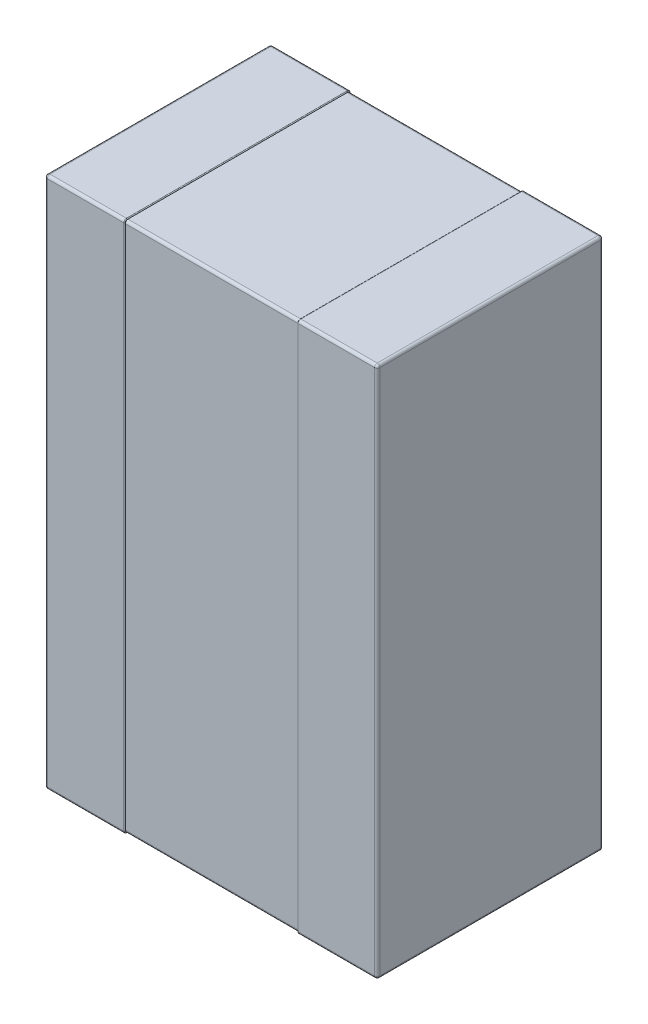
from build123d import *

# Parameters (mm, degrees)
SKETCH1_W                           = 1.25
SKETCH1_H                           = 2
ALL_BODY_DEPTH                      = 0.85
CUT_OUT_THE_BODY_FOR_PIN_DEPTH      = 0.325
CUT_OUT_THE_BODY_FOR_PIN_DEPTH_BACK = 0.325
SKETCH2_OUTSIDE_W                   = 3.352
SKETCH2_OUTSIDE_H                   = 4.502
SKETCH2_OUTSIDE_W_2                 = 0.844
SKETCH2_OUTSIDE_H_2                 = 1.994
BODY_FILLET_R                       = 0.01
PIN_FILLET_A_R                      = 0.01
PIN_FILLET_B_R                      = 0.003


with BuildPart() as part:
    # Sketch1 → All body (new body)
    with BuildSketch(Plane.XY):
        Rectangle(SKETCH1_W, SKETCH1_H)
    extrude(amount=ALL_BODY_DEPTH)

    # Sketch2 outside → Cut out the body for pin (cut, two sides: drawn at the far end of the back side and taken through both)
    with BuildSketch(Plane(origin=(0, 0, 0), x_dir=(0, 0, -1), z_dir=(1, 0, 0)).offset(-CUT_OUT_THE_BODY_FOR_PIN_DEPTH_BACK)):
        with Locations((-0.425, 0)):
            Rectangle(SKETCH2_OUTSIDE_W, SKETCH2_OUTSIDE_H)
        with Locations((-0.425, 0)):
            Rectangle(SKETCH2_OUTSIDE_W_2, SKETCH2_OUTSIDE_H_2, mode=Mode.SUBTRACT)
    extrude(amount=CUT_OUT_THE_BODY_FOR_PIN_DEPTH + CUT_OUT_THE_BODY_FOR_PIN_DEPTH_BACK, mode=Mode.SUBTRACT)

    # Body fillet
    body_fillet_edges = [part.edges().sort_by_distance(p)[0] for p in [
        (0, 0.997, 0.003),
        (0, 0.997, 0.847),
        (0, -0.997, 0.847),
        (0, -0.997, 0.003),
    ]]
    fillet(body_fillet_edges, radius=BODY_FILLET_R)

    # Pin fillet a
    pin_fillet_a_edges = [part.edges().sort_by_distance(p)[0] for p in [
        (0.625, 0, 0.85),
        (-0.475, 1, 0),
        (0.475, -1, 0),
        (0.475, -1, 0.85),
        (-0.475, 1, 0.85),
        (0.475, 1, 0.85),
        (-0.625, 0, 0.85),
        (0.475, 1, 0),
        (0.625, 0, 0),
        (-0.475, -1, 0),
        (-0.625, 0, 0),
        (-0.625, 1, 0.425),
        (0.625, 1, 0.425),
        (0.625, -1, 0.425),
        (-0.625, -1, 0.425),
        (-0.475, -1, 0.85),
    ]]
    fillet(pin_fillet_a_edges, radius=PIN_FILLET_A_R)

    # Pin fillet b
    pin_fillet_b_edges = [part.edges().sort_by_distance(p)[0] for p in [
        (0.325, -1, 0.425),
        (0.325, 0, 0.85),
        (0.325, 1, 0.425),
        (0.325, 0, 0),
        (-0.325, 1, 0.425),
        (-0.325, 0, 0.85),
        (-0.325, -1, 0.425),
        (-0.325, 0, 0),
        (0.325, 0.997071068, 0.002928932),
        (0.325, -0.997071068, 0.002928932),
        (0.325, -0.997071068, 0.847071068),
        (0.325, 0.997071068, 0.847071068),
        (-0.325, -0.997071068, 0.847071068),
        (-0.325, 0.997071068, 0.847071068),
        (-0.325, -0.997071068, 0.002928932),
        (-0.325, 0.997071068, 0.002928932),
    ]]
    fillet(pin_fillet_b_edges, radius=PIN_FILLET_B_R - 0.0001)  # a hair under: the kernel refuses the full size


solid = part.part
